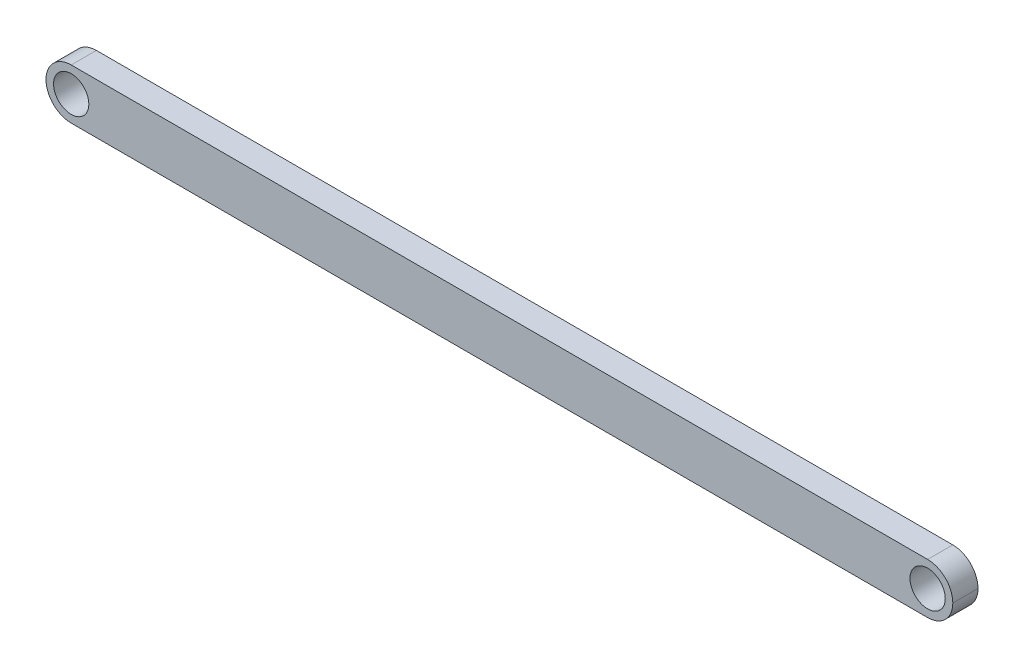
from build123d import *

# Parameters (mm, degrees)
SKETCH_1_W      = 360
SKETCH_1_H      = 20
SKETCH_1_R      = 7
EXTRUDE_1_DEPTH = 10
FILLET_1_R      = 10


with BuildPart() as part:
    # 草图1 → 凸台-拉伸1 (new body)
    with BuildSketch(Plane.XY):
        Rectangle(SKETCH_1_W, SKETCH_1_H)
        with Locations((-170, 0)):
            Circle(SKETCH_1_R, mode=Mode.SUBTRACT)
        with Locations((170, 0)):
            Circle(SKETCH_1_R, mode=Mode.SUBTRACT)
    extrude(amount=EXTRUDE_1_DEPTH)

    # 圆角1
    fillet_1_edges = [part.edges().sort_by_distance(p)[0] for p in [
        (180, 10, 5),
        (180, -10, 5),
        (-180, -10, 5),
        (-180, 10, 5),
    ]]
    fillet(fillet_1_edges, radius=FILLET_1_R - 0.0001)  # a hair under: the kernel refuses the full size


solid = part.part
